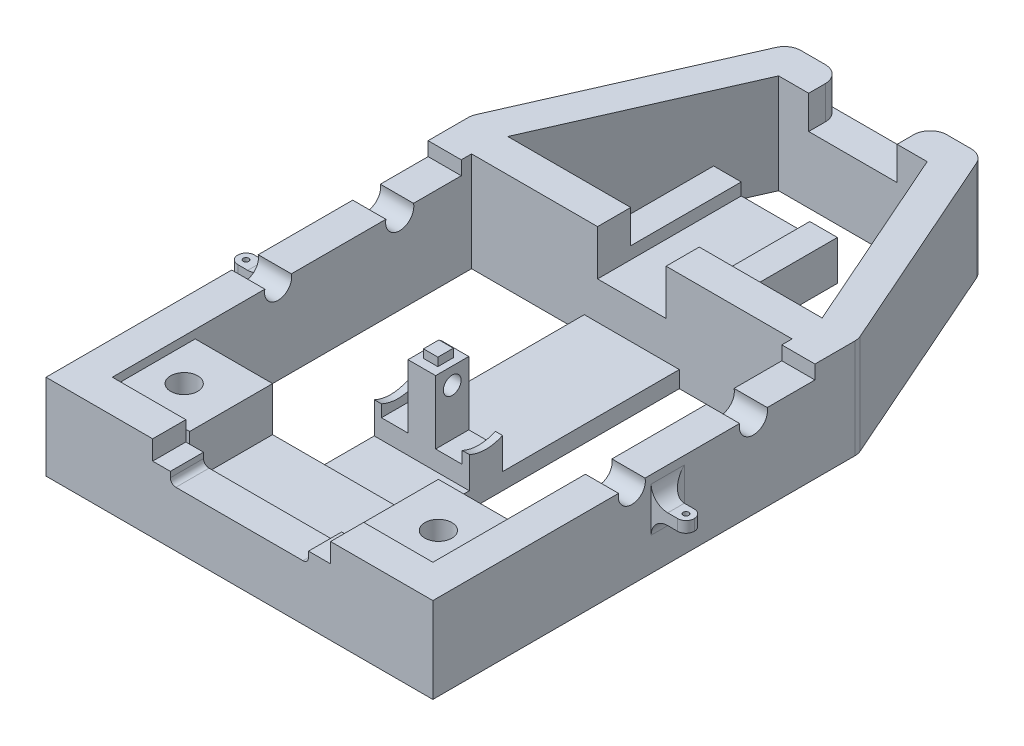
from build123d import *

# Parameters (mm, degrees)
SKETCH1_W               = 58
SKETCH1_H               = 65
BOSS_EXTRUDE1_DEPTH     = 30
BOSS_EXTRUDE3_REACH     = 92.09
SKETCH10_W              = 5
SKETCH10_H              = 6
CUT_EXTRUDE1_REACH      = 111.372
SKETCH2_R               = 2.45
SKETCH2_R_2             = 2.55
CUT_EXTRUDE2_REACH      = 91.744
SKETCH3_W               = 12.4
SKETCH3_H               = 10.4
SKETCH11_W              = 3
SKETCH11_H              = 2
BOSS_EXTRUDE4_DEPTH     = 6.3
FILLET3_R               = 1.5
SKETCH12_R              = 0.5
CUT_EXTRUDE3_DEPTH      = 92.15338732
FILLET3_OF_MIRROR1_R    = 1.5
BOSS_EXTRUDE5_REACH     = 111.564
SKETCH13_W              = 15
SKETCH13_H              = 6
BOSS_EXTRUDE6_REACH     = 111.564
SKETCH17_W              = 15
SKETCH17_H              = 14
SKETCH14_R              = 2.45
CUT_EXTRUDE4_DEPTH      = 94.637279017
SKETCH16_W              = 16
SKETCH16_H              = 7
CUT_EXTRUDE7_DEPTH      = 15
CUT_EXTRUDE8_REACH      = 129.651
CUT_EXTRUDE9_START      = -6
SKETCH19_W              = 30
SKETCH19_H              = 15
CUT_EXTRUDE9_DEPTH      = 18
CUT_EXTRUDE18_REACH     = 129.651
SKETCH35_W              = 16
SKETCH35_H              = 6
FILLET5_R               = 3
BOSS_EXTRUDE7_START     = 20.2
BOSS_EXTRUDE7_DEPTH     = 9.8
CUT_EXTRUDE12_REACH     = 109.009
CUT_EXTRUDE12_START     = 16.5
SKETCH23_W              = 12.3
SKETCH23_H              = 6
BOSS_EXTRUDE8_DEPTH     = 20
CUT_EXTRUDE15_REACH     = 95.168
SKETCH28_R              = 0.8
FILLET4_R               = 3
CUT_EXTRUDE16_REACH     = 96.767
SKETCH29_R              = 1.6
SKETCH30_W              = 6
SKETCH30_H              = 3.5
BOSS_EXTRUDE9_DEPTH     = 6.1
SKETCH31_W              = 1.3
SKETCH31_H              = 6
BOSS_EXTRUDE10_DEPTH    = 5
CUT_EXTRUDE17_REACH     = 99.736
MIRROR5_COPY_1_SKETCH_W = 6
MIRROR5_COPY_1_SKETCH_H = 3.5
MIRROR5_COPY_1_DEPTH    = 6.1
MIRROR5_COPY_2_SKETCH_W = 1.3
MIRROR5_COPY_2_SKETCH_H = 6
MIRROR5_COPY_2_DEPTH    = 5
MIRROR5_COPY_3_REACH    = 99.736
SKETCH36_W              = 164.658600107
SKETCH36_H              = 149.862089959
CUT_EXTRUDE19_DEPTH     = 12
SKETCH37_W              = 5
SKETCH37_H              = 6
CUT_EXTRUDE20_DEPTH     = 2.5
SKETCH38_W              = 32.18776844
SKETCH38_H              = 6
CUT_EXTRUDE21_DEPTH     = 3.5
SKETCH39_W              = 2.6
SKETCH39_H              = 2.8
BOSS_EXTRUDE11_DEPTH    = 1.5


with BuildPart() as part:
    # Sketch1 → Boss-Extrude1 (new body)
    with BuildSketch(Plane(origin=(0, 0, 0), x_dir=(1, 0, 0), z_dir=(0, 1, 0))):
        Polygon((-35, 38.5), (-17.352941176, 78.5), (17.352941947, 78.5), (35, 38.5), (35, -38.5), (-35, -38.5), align=None)
        Rectangle(SKETCH1_W, SKETCH1_H, mode=Mode.SUBTRACT)
        Polygon((-28.44203382, 38.5), (28.442033867, 38.5), (13.442034522, 72.5), (-13.44203382, 72.5), align=None, mode=Mode.SUBTRACT)
    extrude(amount=BOSS_EXTRUDE1_DEPTH)

    # Sketch7 → Loft3 section 0
    with BuildSketch(Plane.XY.offset(-32.5)):
        with BuildLine():
            Line((-8.6, 30), (8.6, 30))
            Line((8.6, 30), (8.6, 27))
            Line((8.6, 27), (-8.6, 27))
            Line((-8.6, 27), (-8.6, 30))
        make_face()
    # Sketch8 → Loft3 section 1
    with BuildSketch(Plane.XY.offset(5.5)):
        with BuildLine():
            Line((-8.6, 30), (8.6, 30))
            Line((8.6, 30), (8.6, 27))
            Line((8.6, 27), (-8.6, 27))
            Line((-8.6, 27), (-8.6, 30))
        make_face()
    loft3 = loft()

    # Mirror3: Loft3 across plane
    add(loft3.mirror(Plane(origin=(0, 15, 0), x_dir=(0, 0, 1), z_dir=(0, -1, 0))))

    # Sketch10 → Boss-Extrude3 (add, up to next)
    with BuildSketch(Plane.XZ.offset(-27), mode=Mode.PRIVATE) as boss_extrude3_sk1:
        with Locations((0, 2.5)):
            Rectangle(SKETCH10_W, SKETCH10_H)
    boss_extrude3_tool1 = extrude(boss_extrude3_sk1.sketch, amount=BOSS_EXTRUDE3_REACH, mode=Mode.PRIVATE) - part.part
    add(boss_extrude3_tool1.solids().sort_by_distance((0, 27, 2.5))[0])

    # Sketch2 → Cut-Extrude1 (cut, up to next)
    with BuildSketch(Plane(origin=(35, 0, 0), x_dir=(0, 0, -1), z_dir=(1, 0, 0)), mode=Mode.PRIVATE) as cut_extrude1_sk1:
        with Locations((-2.5, 15)):
            Circle(SKETCH2_R)
    cut_extrude1_tool1 = extrude(cut_extrude1_sk1.sketch, amount=-CUT_EXTRUDE1_REACH, mode=Mode.PRIVATE) & part.part
    # Sketch2 → Cut-Extrude1 (cut, up to next)
    with BuildSketch(Plane(origin=(35, 0, 0), x_dir=(0, 0, -1), z_dir=(1, 0, 0)), mode=Mode.PRIVATE) as cut_extrude1_sk2:
        with Locations((19.5, 15)):
            Circle(SKETCH2_R_2)
    cut_extrude1_tool2 = extrude(cut_extrude1_sk2.sketch, amount=-CUT_EXTRUDE1_REACH, mode=Mode.PRIVATE) & part.part
    cut_extrude1_1 = cut_extrude1_tool1.solids().sort_by_distance((35, 15, 2.5))[0]
    add(cut_extrude1_1, mode=Mode.SUBTRACT)
    cut_extrude1_2 = cut_extrude1_tool2.solids().sort_by_distance((35, 15, -19.5))[0]
    add(cut_extrude1_2, mode=Mode.SUBTRACT)
    cut_extrude1 = cut_extrude1_1 + cut_extrude1_2  # Cut-Extrude1 as one shape, for the pattern or mirror that repeats it

    # Sketch3 → Cut-Extrude2 (cut, up to next)
    with BuildSketch(Plane(origin=(0, 0, -38.5), x_dir=(-1, 0, 0), z_dir=(0, 0, -1)), mode=Mode.PRIVATE) as cut_extrude2_sk1:
        with Locations((0, 15)):
            Rectangle(SKETCH3_W, SKETCH3_H)
    cut_extrude2_tool1 = extrude(cut_extrude2_sk1.sketch, amount=-CUT_EXTRUDE2_REACH, mode=Mode.PRIVATE) & part.part
    add(cut_extrude2_tool1.solids().sort_by_distance((0, 15, -38.5))[0], mode=Mode.SUBTRACT)

    # Sketch11 → Boss-Extrude4 (add)
    with BuildSketch(Plane(origin=(35, 0, 0), x_dir=(0, 0, -1), z_dir=(1, 0, 0))):
        with Locations((2.5, 20)):
            Rectangle(SKETCH11_W, SKETCH11_H)
        with Locations((2.5, 10)):
            Rectangle(SKETCH11_W, SKETCH11_H)
    boss_extrude4 = extrude(amount=BOSS_EXTRUDE4_DEPTH)

    # Fillet3
    fillet3_edges = [part.edges().sort_by_distance(p)[0] for p in [
        (41.3, 10, -1),
        (41.3, 10, -4),
        (41.3, 20, -1),
        (41.3, 20, -4),
    ]]
    fillet(fillet3_edges, radius=FILLET3_R - 0.0001)  # a hair under: the kernel refuses the full size

    # Sketch12 → Cut-Extrude3 (cut, through all)
    with BuildSketch(Plane(origin=(0, 21, 0), x_dir=(1, 0, 0), z_dir=(0, 1, 0))):
        with Locations(Location((39.8, 2.5, 0), (0, 0, 270))):
            Circle(SKETCH12_R)
    cut_extrude3 = extrude(amount=-CUT_EXTRUDE3_DEPTH, mode=Mode.SUBTRACT)

    # Mirror1: Cut-Extrude1, Boss-Extrude4, Cut-Extrude3 across plane
    add(cut_extrude1.mirror(Plane(origin=(0, 0, 0), x_dir=(0, 0, 1), z_dir=(1, 0, 0))), mode=Mode.SUBTRACT)
    add(boss_extrude4.mirror(Plane(origin=(0, 0, 0), x_dir=(0, 0, 1), z_dir=(1, 0, 0))))
    add(cut_extrude3.mirror(Plane(origin=(0, 0, 0), x_dir=(0, 0, 1), z_dir=(1, 0, 0))), mode=Mode.SUBTRACT)

    # Fillet3 of Mirror1
    fillet3_of_mirror1_edges = [part.edges().sort_by_distance(p)[0] for p in [
        (-41.3, 10, -1),
        (-41.3, 10, -4),
        (-41.3, 20, -1),
        (-41.3, 20, -4),
    ]]
    fillet(fillet3_of_mirror1_edges, radius=FILLET3_OF_MIRROR1_R - 0.0001)  # a hair under: the kernel refuses the full size

    # Sketch13 → Boss-Extrude5 (add, up to next)
    with BuildSketch(Plane(origin=(-29, 0, 0), x_dir=(0, 0, -1), z_dir=(1, 0, 0)), mode=Mode.PRIVATE) as boss_extrude5_sk1:
        with Locations((-25, 27)):
            Rectangle(SKETCH13_W, SKETCH13_H)
    boss_extrude5_tool1 = extrude(boss_extrude5_sk1.sketch, amount=BOSS_EXTRUDE5_REACH, mode=Mode.PRIVATE) - part.part
    add(boss_extrude5_tool1.solids().sort_by_distance((-29, 27, 25))[0])

    # Sketch17 → Boss-Extrude6 (add, up to next)
    with BuildSketch(Plane(origin=(-29, 0, 0), x_dir=(0, 0, -1), z_dir=(1, 0, 0)), mode=Mode.PRIVATE) as boss_extrude6_sk1:
        with Locations((-25, 7)):
            Rectangle(SKETCH17_W, SKETCH17_H)
    boss_extrude6_tool1 = extrude(boss_extrude6_sk1.sketch, amount=BOSS_EXTRUDE6_REACH, mode=Mode.PRIVATE) - part.part
    add(boss_extrude6_tool1.solids().sort_by_distance((-29, 7, 25))[0])

    # Sketch14 → Cut-Extrude4 (cut, through all)
    with BuildSketch(Plane(origin=(0, 30, 0), x_dir=(1, 0, 0), z_dir=(0, 1, 0))):
        with Locations(Location((-23, -25.5, 0), (0, 0, 270))):
            Circle(SKETCH14_R)
        with Locations(Location((23, -25.5, 0), (0, 0, 270))):
            Circle(SKETCH14_R)
    extrude(amount=-CUT_EXTRUDE4_DEPTH, mode=Mode.SUBTRACT)

    # Sketch16 → Cut-Extrude7 (cut)
    with BuildSketch(Plane(origin=(35, 0, 0), x_dir=(0, 0, -1), z_dir=(1, 0, 0))):
        with Locations((-30.5, 19)):
            Rectangle(SKETCH16_W, SKETCH16_H)
    cut_extrude7 = extrude(amount=-CUT_EXTRUDE7_DEPTH, mode=Mode.SUBTRACT)

    # Mirror2: Cut-Extrude7 across plane
    add(cut_extrude7.mirror(Plane(origin=(0, 0, 0), x_dir=(0, 0, 1), z_dir=(1, 0, 0))), mode=Mode.SUBTRACT)

    # Sketch18 → Cut-Extrude8 (cut, up to next)
    with BuildSketch(Plane.XY.offset(38.5), mode=Mode.PRIVATE) as cut_extrude8_sk1:
        with BuildLine():
            Line((-11.5, 14), (11.5, 14))
            ThreePointArc((11.5, 14), (12.207106781, 13.707106781), (12.5, 13))
            Line((12.5, 13), (12.5, 11))
            ThreePointArc((12.5, 11), (12.207106781, 10.292893219), (11.5, 10))
            Line((11.5, 10), (-11.5, 10))
            ThreePointArc((-11.5, 10), (-12.207106781, 10.292893219), (-12.5, 11))
            Line((-12.5, 11), (-12.5, 13))
            ThreePointArc((-12.5, 13), (-12.207106781, 13.707106781), (-11.5, 14))
        make_face()
    cut_extrude8_tool1 = extrude(cut_extrude8_sk1.sketch, amount=-CUT_EXTRUDE8_REACH, mode=Mode.PRIVATE) & part.part
    add(cut_extrude8_tool1.solids().sort_by_distance((0, 12, 38.5))[0], mode=Mode.SUBTRACT)

    # Sketch19 → Cut-Extrude9 (cut)
    with BuildSketch(Plane(origin=(0, 30, 0), x_dir=(1, 0, 0), z_dir=(0, 1, 0)).offset(CUT_EXTRUDE9_START)):
        with Locations((0, -25)):
            Rectangle(SKETCH19_W, SKETCH19_H)
    extrude(amount=-CUT_EXTRUDE9_DEPTH, mode=Mode.SUBTRACT)

    # Sketch35 → Cut-Extrude18 (cut, up to next)
    with BuildSketch(Plane(origin=(0, 0, -78.5), x_dir=(-1, 0, 0), z_dir=(0, 0, -1)), mode=Mode.PRIVATE) as cut_extrude18_sk1:
        with Locations((0, 15)):
            Rectangle(SKETCH35_W, SKETCH35_H)
    cut_extrude18_tool1 = extrude(cut_extrude18_sk1.sketch, amount=-CUT_EXTRUDE18_REACH, mode=Mode.PRIVATE) & part.part
    add(cut_extrude18_tool1.solids().sort_by_distance((0, 15, -78.5))[0], mode=Mode.SUBTRACT)

    # Fillet5
    fillet5_edges = [part.edges().sort_by_distance(p)[0] for p in [
        (-35, 15, -38.5),
        (-17.352941176, 15, -78.5),
        (17.352941947, 15, -78.5),
        (35, 15, -38.5),
        (-8, 15, -78.5),
        (8, 15, -78.5),
    ]]
    fillet(fillet5_edges, radius=FILLET5_R)

    # Sketch24 → Boss-Extrude7 (add)
    with BuildSketch(Plane(origin=(0, 0, 0), x_dir=(1, 0, 0), z_dir=(0, 1, 0)).offset(BOSS_EXTRUDE7_START)):
        Polygon((9.15, 52.5), (9.15, 72.5), (6.15, 72.5), (6.15, 49.5), (-6.15, 49.5), (-6.15, 72.5), (-9.15, 72.5), (-9.15, 49.5), (-23.589092644, 49.5), (-26.23615161, 43.5), (26.23615161, 43.5), (22.346632225, 52.316244325), align=None)
    extrude(amount=BOSS_EXTRUDE7_DEPTH)

    # Sketch23 → Cut-Extrude12 (cut, up to next)
    with BuildSketch(Plane(origin=(0, 12, 0), x_dir=(1, 0, 0), z_dir=(0, 1, 0)).offset(CUT_EXTRUDE12_START), mode=Mode.PRIVATE) as cut_extrude12_sk1:
        with Locations((0, 75.5)):
            Rectangle(SKETCH23_W, SKETCH23_H)
    cut_extrude12_tool1 = extrude(cut_extrude12_sk1.sketch, amount=CUT_EXTRUDE12_REACH, mode=Mode.PRIVATE) & part.part
    # Sketch23 → Cut-Extrude12 (cut, up to next)
    with BuildSketch(Plane(origin=(0, 12, 0), x_dir=(1, 0, 0), z_dir=(0, 1, 0)).offset(CUT_EXTRUDE12_START), mode=Mode.PRIVATE) as cut_extrude12_sk2:
        with Locations((0, 46.5)):
            Rectangle(SKETCH23_W, SKETCH23_H)
    cut_extrude12_tool2 = extrude(cut_extrude12_sk2.sketch, amount=CUT_EXTRUDE12_REACH, mode=Mode.PRIVATE) & part.part
    add(cut_extrude12_tool1.solids().sort_by_distance((0, 28.5, -75.5))[0], mode=Mode.SUBTRACT)
    add(cut_extrude12_tool2.solids().sort_by_distance((0, 28.5, -46.5))[0], mode=Mode.SUBTRACT)

    # Sketch26 → Boss-Extrude8 (add)
    with BuildSketch(Plane(origin=(0, 0, -38.5), x_dir=(-1, 0, 0), z_dir=(0, 0, -1))):
        Polygon((-6.2, 9.8), (6.2, 9.8), (6.2, 12), (11.2, 12), (11.2, 4.8), (-11.2, 4.8), (-11.2, 12), (-6.2, 12), align=None)
    extrude(amount=BOSS_EXTRUDE8_DEPTH)

    # Sketch28 → Cut-Extrude15 (cut, up to next)
    with BuildSketch(Plane(origin=(0, 28.5, 0), x_dir=(-1, 0, 0), z_dir=(0, 1, 0)), mode=Mode.PRIVATE) as cut_extrude15_sk1:
        with Locations(Location((0, -46.5, 0), (0, 0, 90))):
            Circle(SKETCH28_R)
    cut_extrude15_tool1 = extrude(cut_extrude15_sk1.sketch, amount=-CUT_EXTRUDE15_REACH, mode=Mode.PRIVATE) & part.part
    # Sketch28 → Cut-Extrude15 (cut, up to next)
    with BuildSketch(Plane(origin=(0, 28.5, 0), x_dir=(-1, 0, 0), z_dir=(0, 1, 0)), mode=Mode.PRIVATE) as cut_extrude15_sk2:
        with Locations(Location((0, -75.5, 0), (0, 0, 90))):
            Circle(SKETCH28_R)
    cut_extrude15_tool2 = extrude(cut_extrude15_sk2.sketch, amount=-CUT_EXTRUDE15_REACH, mode=Mode.PRIVATE) & part.part
    add(cut_extrude15_tool1.solids().sort_by_distance((0, 28.5, -46.5))[0], mode=Mode.SUBTRACT)
    add(cut_extrude15_tool2.solids().sort_by_distance((0, 28.5, -75.5))[0], mode=Mode.SUBTRACT)

    # Fillet4
    fillet4_edges = [part.edges().sort_by_distance(p)[0] for p in [
        (35, 19, -2.5),
        (35, 20, -4),
        (35, 21, -2.5),
        (35, 11, -2.5),
        (35, 9, -2.5),
        (35, 10, -4),
        (-35, 19, -2.5),
        (-35, 20, -4),
        (-35, 21, -2.5),
        (-35, 11, -2.5),
        (-35, 9, -2.5),
        (-35, 10, -4),
    ]]
    fillet(fillet4_edges, radius=FILLET4_R)

    # Sketch29 → Cut-Extrude16 (cut, up to next)
    with BuildSketch(Plane(origin=(2.5, 0, 0), x_dir=(0, 0, -1), z_dir=(1, 0, 0)), mode=Mode.PRIVATE) as cut_extrude16_sk1:
        with Locations(Location((-2.5, 15, 0), (0, 0, 90))):
            Circle(SKETCH29_R)
    cut_extrude16_tool1 = extrude(cut_extrude16_sk1.sketch, amount=-CUT_EXTRUDE16_REACH, mode=Mode.PRIVATE) & part.part
    add(cut_extrude16_tool1.solids().sort_by_distance((2.5, 15, 2.5))[0], mode=Mode.SUBTRACT)

    # Sketch30 → Boss-Extrude9 (add)
    with BuildSketch(Plane.ZY.offset(2.5)):
        with Locations((2.5, 25.25)):
            Rectangle(SKETCH30_W, SKETCH30_H)
    boss_extrude9 = extrude(amount=BOSS_EXTRUDE9_DEPTH)

    # Sketch31 → Boss-Extrude10 (add)
    with BuildSketch(Plane.XZ.offset(-23.5)):
        with Locations((-7.95, 2.5)):
            Rectangle(SKETCH31_W, SKETCH31_H)
    boss_extrude10 = extrude(amount=BOSS_EXTRUDE10_DEPTH)

    # Sketch32 → Cut-Extrude17 (cut, up to next)
    with BuildSketch(Plane.ZY.offset(8.6), mode=Mode.PRIVATE) as cut_extrude17_sk1:
        with BuildLine():
            Line((-0.5, 18.5), (-0.5, 21.32455532))
            ThreePointArc((-0.5, 21.32455532), (2.5, 22), (5.5, 21.32455532))
            Line((5.5, 21.32455532), (5.5, 18.5))
            Line((5.5, 18.5), (-0.5, 18.5))
        make_face()
    cut_extrude17_tool1 = extrude(cut_extrude17_sk1.sketch, amount=-CUT_EXTRUDE17_REACH, mode=Mode.PRIVATE) & part.part
    cut_extrude17 = cut_extrude17_tool1.solids().sort_by_distance((-8.6, 20.145783, 2.5))[0]
    add(cut_extrude17, mode=Mode.SUBTRACT)

    # Mirror4: Boss-Extrude9, Boss-Extrude10, Cut-Extrude17 across plane
    add(boss_extrude9.mirror(Plane(origin=(0, 15, 0), x_dir=(0, 0, 1), z_dir=(0, -1, 0))))
    add(boss_extrude10.mirror(Plane(origin=(0, 15, 0), x_dir=(0, 0, 1), z_dir=(0, -1, 0))))
    add(cut_extrude17.mirror(Plane(origin=(0, 15, 0), x_dir=(0, 0, 1), z_dir=(0, -1, 0))), mode=Mode.SUBTRACT)

    # Mirror5: Boss-Extrude9, Boss-Extrude10, Cut-Extrude17 across plane
    add(boss_extrude9.mirror(Plane(origin=(0, 0, 0), x_dir=(0, 0, 1), z_dir=(1, 0, 0))))
    add(boss_extrude10.mirror(Plane(origin=(0, 0, 0), x_dir=(0, 0, 1), z_dir=(1, 0, 0))))
    add(cut_extrude17.mirror(Plane(origin=(0, 0, 0), x_dir=(0, 0, 1), z_dir=(1, 0, 0))), mode=Mode.SUBTRACT)

    # Mirror5 copy 1 sketch → Mirror5 copy 1 (add)
    with BuildSketch(Plane(origin=(2.5, 30, 0), x_dir=(0, 0, 1), z_dir=(1, 0, 0))):
        with Locations((2.5, 25.25)):
            Rectangle(MIRROR5_COPY_1_SKETCH_W, MIRROR5_COPY_1_SKETCH_H)
    extrude(amount=MIRROR5_COPY_1_DEPTH)

    # Mirror5 copy 2 sketch → Mirror5 copy 2 (add)
    with BuildSketch(Plane(origin=(0, 6.5, 0), x_dir=(-1, 0, 0), z_dir=(0, 1, 0))):
        with Locations((-7.95, 2.5)):
            Rectangle(MIRROR5_COPY_2_SKETCH_W, MIRROR5_COPY_2_SKETCH_H)
    extrude(amount=MIRROR5_COPY_2_DEPTH)

    # Mirror5 copy 3 sketch → Mirror5 copy 3 (cut, up to next)
    with BuildSketch(Plane(origin=(8.6, 30, 0), x_dir=(0, 0, 1), z_dir=(1, 0, 0)), mode=Mode.PRIVATE) as mirror5_copy_3_sk1:
        with BuildLine():
            Line((-0.5, 18.5), (-0.5, 21.32455532))
            ThreePointArc((-0.5, 21.32455532), (2.5, 22), (5.5, 21.32455532))
            Line((5.5, 21.32455532), (5.5, 18.5))
            Line((5.5, 18.5), (-0.5, 18.5))
        make_face()
    mirror5_copy_3_tool1 = extrude(mirror5_copy_3_sk1.sketch, amount=-MIRROR5_COPY_3_REACH, mode=Mode.PRIVATE) & part.part
    add(mirror5_copy_3_tool1.solids().sort_by_distance((8.6, 9.854217, 2.5))[0], mode=Mode.SUBTRACT)

    # Sketch33 → Loft4 section 0
    with BuildSketch(Plane.XY.offset(5.5)):
        with BuildLine():
            Line((-8.6, 30), (8.6, 30))
            Line((8.6, 30), (8.6, 27))
            Line((8.6, 27), (-8.6, 27))
            Line((-8.6, 27), (-8.6, 30))
        make_face()
    # Sketch34 → Loft4 section 1
    with BuildSketch(Plane(origin=(0, 0, 17.5), x_dir=(-1, 0, 0), z_dir=(0, 0, -1))):
        with BuildLine():
            Line((-8.6, 30), (8.6, 30))
            Line((8.6, 30), (8.6, 27))
            Line((8.6, 27), (-8.6, 27))
            Line((-8.6, 27), (-8.6, 30))
        make_face()
    loft4 = loft()

    # Mirror6: Loft4 across plane
    add(loft4.mirror(Plane(origin=(0, 15, 0), x_dir=(0, 0, 1), z_dir=(0, -1, 0))))

    # Sketch36 → Cut-Extrude19 (cut)
    with BuildSketch(Plane(origin=(0, 30, 0), x_dir=(1, 0, 0), z_dir=(0, 1, 0))):
        with Locations((2.558914309, 20.716820694)):
            Rectangle(SKETCH36_W, SKETCH36_H)
    extrude(amount=-CUT_EXTRUDE19_DEPTH, mode=Mode.SUBTRACT)

    # Sketch37 → Cut-Extrude20 (cut)
    with BuildSketch(Plane(origin=(0, 18, 0), x_dir=(1, 0, 0), z_dir=(0, 1, 0))):
        Polygon((35, 30.636970377), (-54.070998832, 30.636970377), (-54.070998832, -45.113589703), (35, -45.113589703), (52.4824214, -45.113589703), (52.4824214, 30.636970377), align=None)
        with Locations((0, -2.5)):
            Rectangle(SKETCH37_W, SKETCH37_H, mode=Mode.SUBTRACT)
    extrude(amount=-CUT_EXTRUDE20_DEPTH, mode=Mode.SUBTRACT)

    # Sketch38 → Cut-Extrude21 (cut)
    with BuildSketch(Plane(origin=(0, 15.5, 0), x_dir=(1, 0, 0), z_dir=(0, 1, 0))):
        with Locations((0.398006196, -35.5)):
            Rectangle(SKETCH38_W, SKETCH38_H)
    extrude(amount=-CUT_EXTRUDE21_DEPTH, mode=Mode.SUBTRACT)

    # Sketch39 → Boss-Extrude11 (add)
    with BuildSketch(Plane(origin=(0, 18, 0), x_dir=(1, 0, 0), z_dir=(0, 1, 0))):
        with Locations((0, -2.5)):
            Rectangle(SKETCH39_W, SKETCH39_H)
    extrude(amount=BOSS_EXTRUDE11_DEPTH)


solid = part.part
